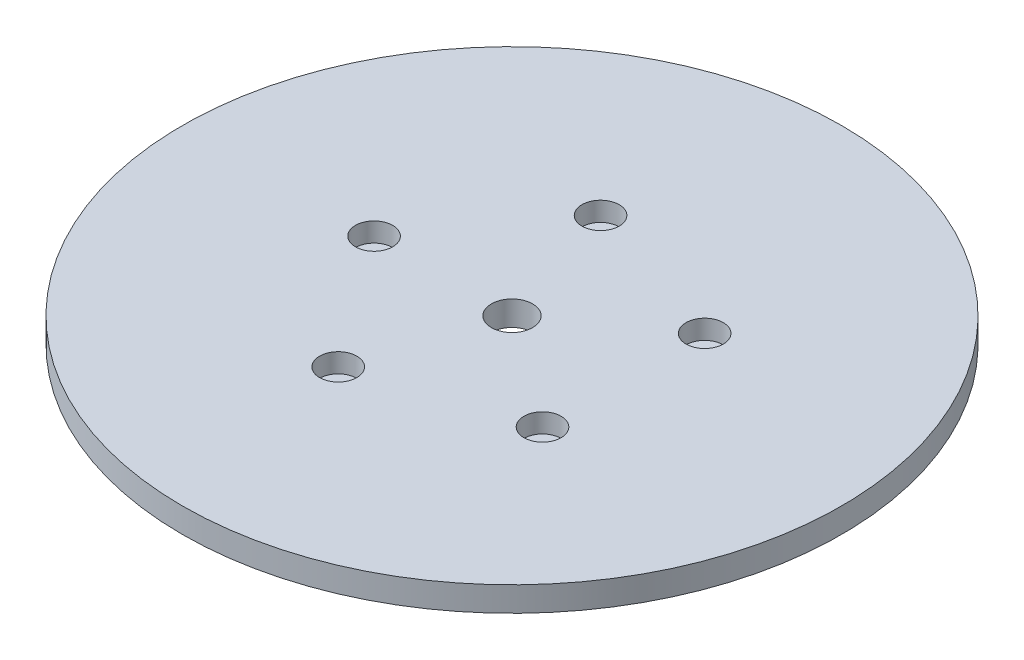
from build123d import *

# Parameters (mm, degrees)
SKETCH1_R           = 80
BOSS_EXTRUDE1_DEPTH = 6
SKETCH2_R           = 5
CUT_EXTRUDE1_DEPTH  = 114.296072306
SKETCH3_R           = 4.519333829
CUT_EXTRUDE2_DEPTH  = 4.673249314
CIRPATTERN1_COUNT   = 5


with BuildPart() as part:
    # Sketch1 → Boss-Extrude1 (new body)
    with BuildSketch(Plane(origin=(0, 0, 0), x_dir=(1, 0, 0), z_dir=(0, 1, 0))):
        Circle(SKETCH1_R)
    extrude(amount=BOSS_EXTRUDE1_DEPTH)

    # Sketch2 → Cut-Extrude1 (cut, through all)
    with BuildSketch(Plane(origin=(0, 0, 0), x_dir=(1, 0, 0), z_dir=(0, 1, 0))):
        Circle(SKETCH2_R)
    extrude(amount=CUT_EXTRUDE1_DEPTH, mode=Mode.SUBTRACT)

    # Sketch3 → Cut-Extrude2 (cut)
    with BuildSketch(Plane(origin=(0, 6, 0), x_dir=(1, 0, 0), z_dir=(0, 1, 0))):
        with Locations((-33.482396153, 0)):
            Circle(SKETCH3_R)
    cut_extrude2 = extrude(amount=-CUT_EXTRUDE2_DEPTH, mode=Mode.SUBTRACT)

    # CirPattern1: Cut-Extrude2 ×5 about axis
    cirpattern1_axis = Axis((0, 0, 0), (0, 1, 0))
    for i in range(1, CIRPATTERN1_COUNT):
        add(cut_extrude2.rotate(cirpattern1_axis, i * 360 / CIRPATTERN1_COUNT), mode=Mode.SUBTRACT)


solid = part.part
